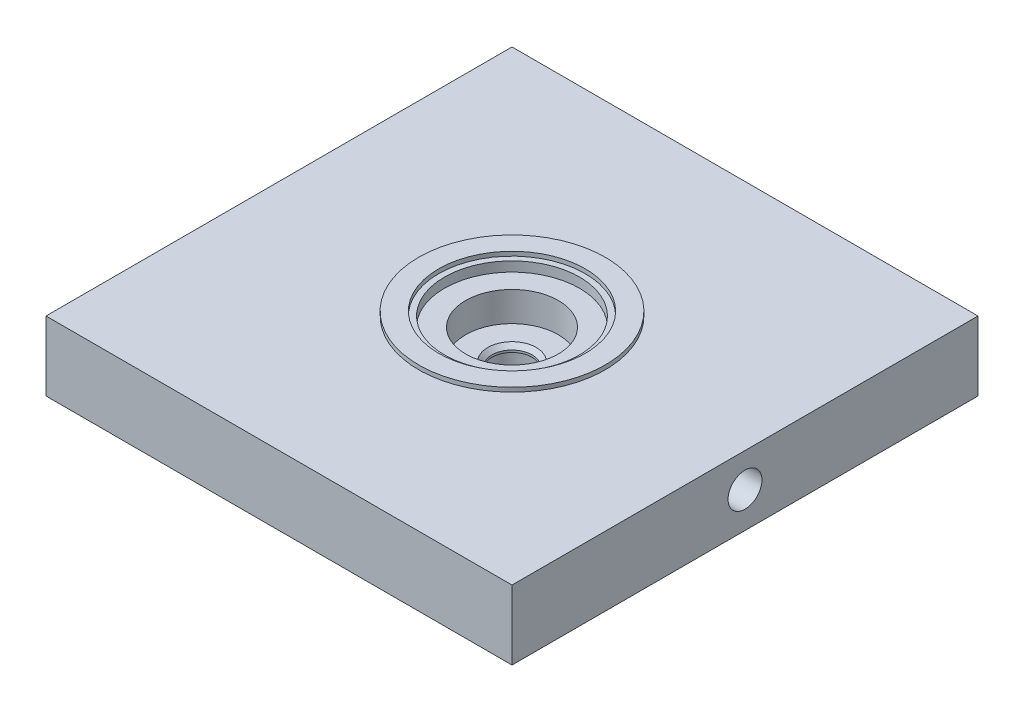
from build123d import *

# Parameters (mm, degrees)
SKETCH2_W               = 55
SKETCH2_H               = 55
SKETCH2_R               = 20
BOSS_EXTRUDE1_DEPTH     = 8.18
CUT_EXTRUDE1_REACH      = 63.892
CUT_EXTRUDE1_END_RADIUS = 5.47
SKETCH3_R               = 2


# Read off the part's stored shape, not the designer's step: Revolve2
with BuildPart() as part:
    # Revolve2 outline → Revolve2 (revolve)
    with BuildSketch(Plane.XY):
        Polygon((2.86451, -3.5), (2.36451, -4), (2.36451, -4.25), (3.06451, -4.25), (3.06451, -6.03), (0.25, -6.03), (0.25, -7.03), (20, -7.03), (20, 1.15), (11.01, 1.15), (11.01, 1.65), (8.65, 1.65), (8.65, 1.15), (7.97, 1.15), (7.97, 0), (5.47, 0), (5.47, -3.5), align=None)
    revolve(axis=Axis((0, 0, 0), (0, 1, 0)))

    # Sketch2 → Boss-Extrude1 (add)
    with BuildSketch(Plane(origin=(0, 1.15, 0), x_dir=(1, 0, 0), z_dir=(0, 1, 0))):
        Rectangle(SKETCH2_W, SKETCH2_H)
        Circle(SKETCH2_R, mode=Mode.SUBTRACT)
    extrude(amount=-BOSS_EXTRUDE1_DEPTH)

    # Cut-Extrude1: up to this cylinder (the profile starts outside it)
    cut_extrude1_end = Plane(origin=(0, -2.85, 0), z_dir=(0, 1, 0)) * Cylinder(CUT_EXTRUDE1_END_RADIUS, 139.724, mode=Mode.PRIVATE)
    # Sketch3 → Cut-Extrude1 (cut, up to the surface)
    with BuildSketch(Plane(origin=(27.5, 0, 0), x_dir=(0, 0, -1), z_dir=(1, 0, 0)), mode=Mode.PRIVATE) as cut_extrude1_sk1:
        with Locations((0, -2.85)):
            Circle(SKETCH3_R)
    cut_extrude1_tool1 = extrude(cut_extrude1_sk1.sketch, amount=-CUT_EXTRUDE1_REACH, mode=Mode.PRIVATE) - cut_extrude1_end
    add(cut_extrude1_tool1.solids().sort_by_distance((27.5, -2.85, 0))[0], mode=Mode.SUBTRACT)


solid = part.part
